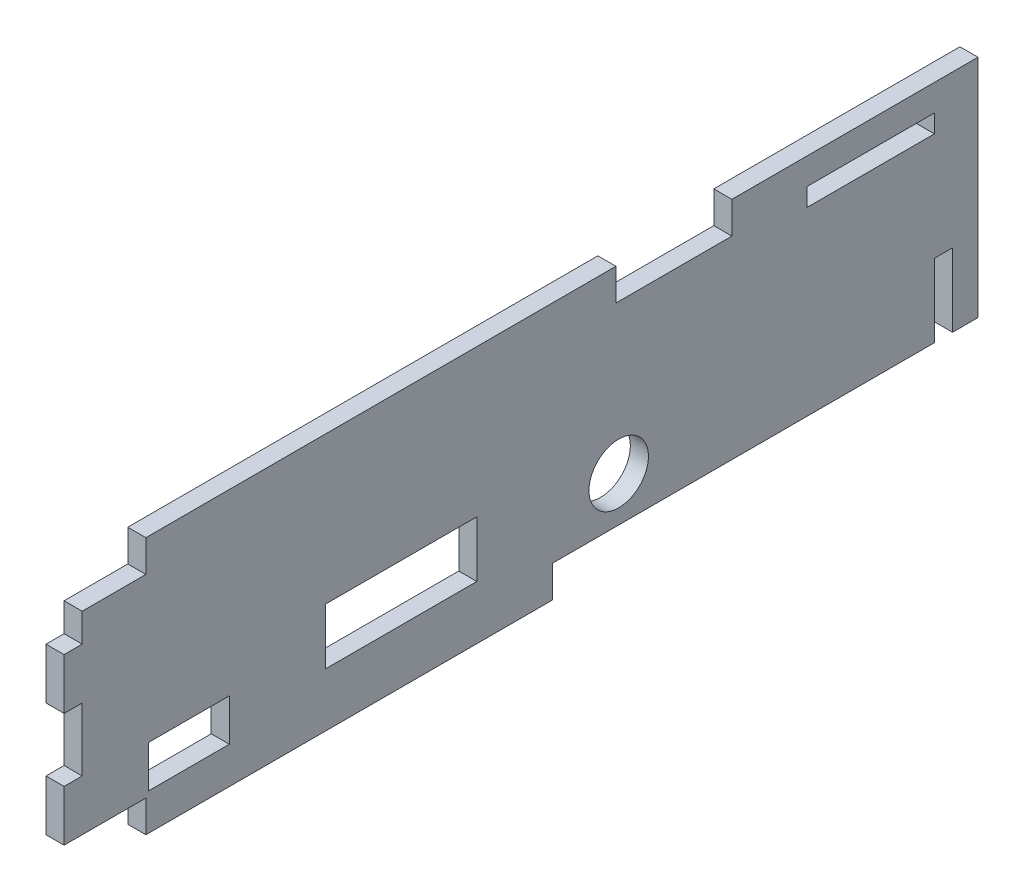
from build123d import *

# Parameters (mm, degrees)
SKETCH2_W           = 12.7
SKETCH2_H           = 1.8034
SKETCH2_W_2         = 8.0391
SKETCH2_H_2         = 4.1783
SKETCH2_W_3         = 15.0876
SKETCH2_H_3         = 5.588
SKETCH2_R           = 2.96545
BOSS_EXTRUDE1_DEPTH = 1.8034


with BuildPart() as part:
    # Sketch2 → Boss-Extrude1 (new body)
    with BuildSketch(Plane(origin=(0, 0, 0), x_dir=(0, 0, -1), z_dir=(1, 0, 0))):
        Polygon((6.35, 24.0284), (0, 24.0284), (0, 21.1836), (-1.8034, 21.1836), (-1.8034, 16.1036), (0, 16.1036), (0, 9.8044), (-1.8034, 9.8044), (-1.8034, 4.7244), (6.35, 4.7244), (6.35, 1.5494), (46.863, 1.5494), (46.863, 4.7244), (84.963, 4.7244), (84.963, 12.0142), (86.7664, 12.0142), (86.7664, 4.7244), (89.3064, 4.7244), (89.3064, 27.2034), (64.77, 27.2034), (64.77, 24.0284), (53.213, 24.0284), (53.213, 27.2034), (6.35, 27.2034), align=None)
        with Locations((78.613, 23.6601)):
            Rectangle(SKETCH2_W, SKETCH2_H, mode=Mode.SUBTRACT)
        with Locations((10.64895, 7.29615)):
            Rectangle(SKETCH2_W_2, SKETCH2_H_2, mode=Mode.SUBTRACT)
        with Locations((31.8008, 9.7155)):
            Rectangle(SKETCH2_W_3, SKETCH2_H_3, mode=Mode.SUBTRACT)
        with Locations((53.48605, 9.17575)):
            Circle(SKETCH2_R, mode=Mode.SUBTRACT)
    extrude(amount=BOSS_EXTRUDE1_DEPTH)


solid = part.part
